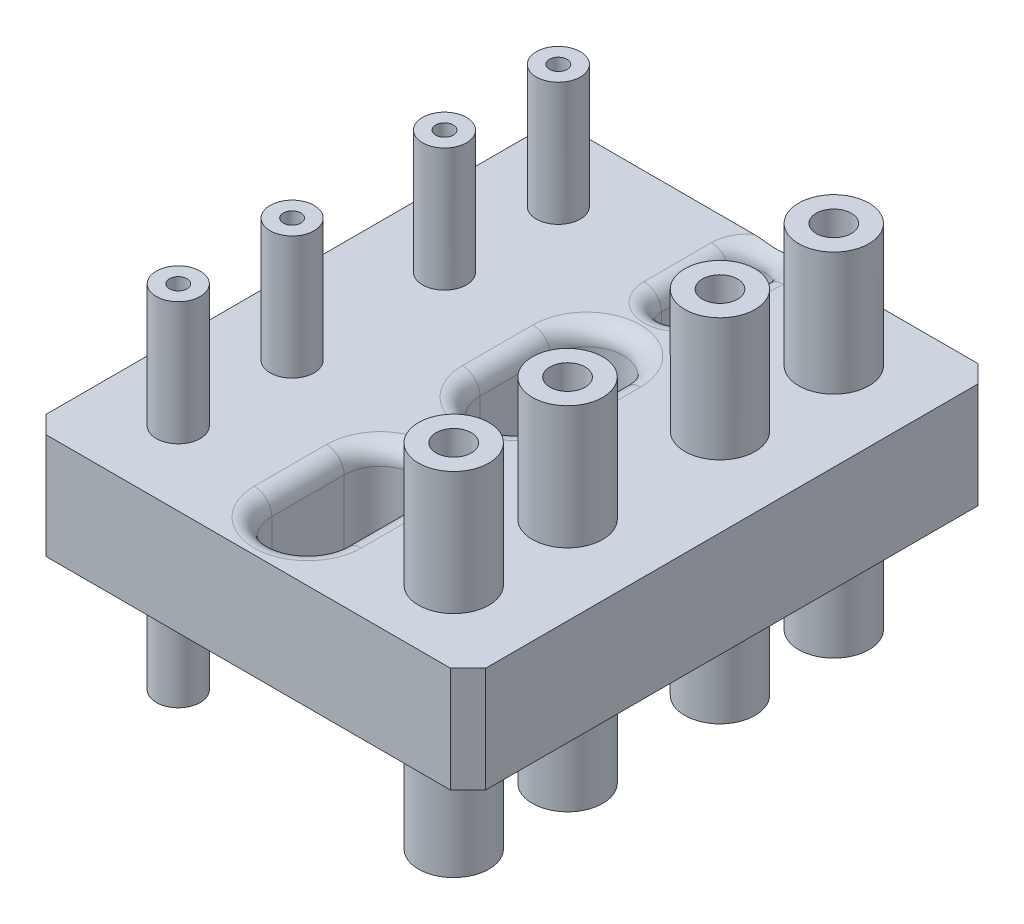
from build123d import *

# Parameters (mm, degrees)
BOSS_EXTRUDE1_START   = -10
SKETCH2_W             = 250
SKETCH2_H             = 150
BOSS_EXTRUDE1_DEPTH   = 40
SKETCH4_R             = 12.5
SKETCH4_R_2           = 20
BOSS_EXTRUDE2_DEPTH   = 70
MIRROR1_START         = -30
MIRROR1_OUTLINE_W     = 250
MIRROR1_OUTLINE_H     = 300
MIRROR1_DEPTH         = 60
MIRROR1_START_2       = -100
MIRROR1_2_OUTLINE_R   = 12.5
MIRROR1_2_OUTLINE_R_2 = 20
MIRROR1_2_DEPTH       = 200
CHAMFER1_SIZE         = 10
SKETCH5_R             = 10
SKETCH5_R_2           = 5
CUT_EXTRUDE1_DEPTH    = 155
CUT_EXTRUDE2_DEPTH    = 140
FILLET1_R             = 10


# Read off the part's stored shape, not the designer's step: Mirror1
with BuildPart() as part:
    # Sketch2 → Boss-Extrude1 (new body)
    with BuildSketch(Plane(origin=(0, 0, 0), x_dir=(1, 0, 0), z_dir=(0, 1, 0)).offset(BOSS_EXTRUDE1_START)):
        Rectangle(SKETCH2_W, SKETCH2_H)
    extrude(amount=BOSS_EXTRUDE1_DEPTH)

    # Sketch4 → Boss-Extrude2 (add)
    with BuildSketch(Plane(origin=(0, 30, 0), x_dir=(1, 0, 0), z_dir=(0, 1, 0))):
        with Locations(Location((-81.710606218, -33.069718751, 0), (0, 0, 270))):
            Circle(SKETCH4_R)
        with Locations(Location((-81.710606218, 31.672231224, 0), (0, 0, 270))):
            Circle(SKETCH4_R)
        with Locations(Location((74.923143721, 31.672231224, 0), (0, 0, 270))):
            Circle(SKETCH4_R_2)
        with Locations(Location((74.923143721, -33.069718751, 0), (0, 0, 270))):
            Circle(SKETCH4_R_2)
    extrude(amount=BOSS_EXTRUDE2_DEPTH)

    # Mirror1 outline → Mirror1 (add)
    with BuildSketch(Plane(origin=(0, 0, 0), x_dir=(1, 0, 0), z_dir=(0, 1, 0)).offset(MIRROR1_START)):
        with Locations((0, 75)):
            Rectangle(MIRROR1_OUTLINE_W, MIRROR1_OUTLINE_H)
    extrude(amount=MIRROR1_DEPTH)

    # Mirror1 2 outline → Mirror1 2 (add)
    with BuildSketch(Plane(origin=(0, 0, 0), x_dir=(1, 0, 0), z_dir=(0, 1, 0)).offset(MIRROR1_START_2)):
        with Locations((-81.710606218, -33.069718751)):
            Circle(MIRROR1_2_OUTLINE_R)
        with Locations((-81.710606218, 31.672231224)):
            Circle(MIRROR1_2_OUTLINE_R)
        with Locations((74.923143721, 31.672231224)):
            Circle(MIRROR1_2_OUTLINE_R_2)
        with Locations((74.923143721, -33.069718751)):
            Circle(MIRROR1_2_OUTLINE_R_2)
        with Locations((-81.710606218, 183.069718751)):
            Circle(MIRROR1_2_OUTLINE_R)
        with Locations((-81.710606218, 118.327768776)):
            Circle(MIRROR1_2_OUTLINE_R)
        with Locations((74.923143721, 118.327768776)):
            Circle(MIRROR1_2_OUTLINE_R_2)
        with Locations((74.923143721, 183.069718751)):
            Circle(MIRROR1_2_OUTLINE_R_2)
    extrude(amount=MIRROR1_2_DEPTH)

    # Chamfer1
    chamfer1_edges = [part.edges().sort_by_distance(p)[0] for p in [
        (125, 0, -225),
        (-125, 0, -225),
        (125, 0, 75),
        (-125, 0, 75),
    ]]
    chamfer(chamfer1_edges, length=CHAMFER1_SIZE)

    # Sketch5 → Cut-Extrude1 (cut, symmetric)
    with BuildSketch(Plane(origin=(0, 30, 0), x_dir=(1, 0, 0), z_dir=(0, 1, 0))):
        with Locations(Location((74.923143721, 183.069718751, 0), (0, 0, 270))):
            Circle(SKETCH5_R)
        with Locations(Location((74.923143721, 118.327768776, 0), (0, 0, 270))):
            Circle(SKETCH5_R)
        with Locations(Location((74.923143721, 31.672231224, 0), (0, 0, 270))):
            Circle(SKETCH5_R)
        with Locations(Location((74.923143721, -33.069718751, 0), (0, 0, 270))):
            Circle(SKETCH5_R)
        with Locations(Location((-81.710606218, -33.069718751, 0), (0, 0, 270))):
            Circle(SKETCH5_R_2)
        with Locations(Location((-81.710606218, 31.672231224, 0), (0, 0, 270))):
            Circle(SKETCH5_R_2)
        with Locations(Location((-81.710606218, 118.327768776, 0), (0, 0, 270))):
            Circle(SKETCH5_R_2)
        with Locations(Location((-81.710606218, 183.069718751, 0), (0, 0, 270))):
            Circle(SKETCH5_R_2)
    extrude(amount=CUT_EXTRUDE1_DEPTH, both=True, mode=Mode.SUBTRACT)

    # Sketch7 → Cut-Extrude2 (cut, symmetric)
    with BuildSketch(Plane(origin=(0, 30, 0), x_dir=(1, 0, 0), z_dir=(0, 1, 0))):
        with BuildLine():
            Line((20.426592509, 0), (20.426592509, -41.165027597))
            ThreePointArc((20.426592509, -41.165027597), (0, -61.591620106), (-20.426592509, -41.165027597))
            Line((-20.426592509, -41.165027597), (-20.426592509, 0))
            ThreePointArc((-20.426592509, 0), (0, 20.426592509), (20.426592509, 0))
        make_face()
        with BuildLine():
            Line((-20.614221034, 77.398424778), (-20.614221034, 117.499578133))
            ThreePointArc((-20.614221034, 117.499578133), (0, 138.113799167), (20.614221034, 117.499578133))
            Line((20.614221034, 117.499578133), (20.614221034, 77.398424778))
            ThreePointArc((20.614221034, 77.398424778), (0, 56.784203744), (-20.614221034, 77.398424778))
        make_face()
        with BuildLine():
            Line((-10.375628688, 170.39897192), (-10.375628688, 208.793693217))
            ThreePointArc((-10.375628688, 208.793693217), (0, 219.169321905), (10.375628688, 208.793693217))
            Line((10.375628688, 208.793693217), (10.375628688, 170.39897192))
            ThreePointArc((10.375628688, 170.39897192), (0, 160.023343232), (-10.375628688, 170.39897192))
        make_face()
    extrude(amount=CUT_EXTRUDE2_DEPTH, both=True, mode=Mode.SUBTRACT)

    # Fillet1
    # the kernel refuses this fillet: 10 mm, written as the material it takes off along each edge
    with BuildSketch(Plane(origin=(10.375628688, -30, -208.793693217), x_dir=(1, 0, 0), z_dir=(0, 0, 1)), Plane(origin=(-10.375628688, -30, -170.39897192), x_dir=(-1, 0, 0), z_dir=(0, 0, -1)), Plane(origin=(-10.375628688, 30, -208.793693217), x_dir=(-1, 0, 0), z_dir=(0, 0, 1)), Plane(origin=(10.375628688, 30, -170.39897192), x_dir=(1, 0, 0), z_dir=(0, 0, -1))) as fillet1_piece_1:
        with BuildLine():
            CenterArc((FILLET1_R, FILLET1_R), FILLET1_R, 180, 90)
            Line((0, FILLET1_R), (0, 0))
            Line((0, 0), (FILLET1_R, 0))
        make_face()
    extrude(amount=38.394721297, mode=Mode.SUBTRACT)
    with BuildSketch(Plane(origin=(0, -30, -208.793693217), x_dir=(1, 0, 0), z_dir=(0, 0, 1))) as fillet1_piece_2:
        with BuildLine():
            CenterArc((10.375628688 + FILLET1_R, FILLET1_R), FILLET1_R, 180, 90)
            Line((10.375628688, FILLET1_R), (10.375628688, 0))
            Line((10.375628688, 0), (10.375628688 + FILLET1_R, 0))
        make_face()
    revolve(axis=Axis((0, -30, -208.793693217), (0, 1, 0)), revolution_arc=180, mode=Mode.SUBTRACT)
    with BuildSketch(Plane(origin=(0, -30, -170.39897192), x_dir=(-1, 0, 0), z_dir=(0, 0, -1))) as fillet1_piece_3:
        with BuildLine():
            CenterArc((10.375628688 + FILLET1_R, FILLET1_R), FILLET1_R, 180, 90)
            Line((10.375628688, FILLET1_R), (10.375628688, 0))
            Line((10.375628688, 0), (10.375628688 + FILLET1_R, 0))
        make_face()
    revolve(axis=Axis((0, -30, -170.39897192), (0, 1, 0)), revolution_arc=180, mode=Mode.SUBTRACT)
    with BuildSketch(Plane(origin=(20.614221034, -30, -117.499578133), x_dir=(1, 0, 0), z_dir=(0, 0, 1)), Plane(origin=(-20.614221034, -30, -77.398424778), x_dir=(-1, 0, 0), z_dir=(0, 0, -1)), Plane(origin=(-20.614221034, 30, -117.499578133), x_dir=(-1, 0, 0), z_dir=(0, 0, 1)), Plane(origin=(20.614221034, 30, -77.398424778), x_dir=(1, 0, 0), z_dir=(0, 0, -1))) as fillet1_piece_4:
        with BuildLine():
            CenterArc((FILLET1_R, FILLET1_R), FILLET1_R, 180, 90)
            Line((0, FILLET1_R), (0, 0))
            Line((0, 0), (FILLET1_R, 0))
        make_face()
    extrude(amount=40.101153355, mode=Mode.SUBTRACT)
    with BuildSketch(Plane(origin=(0, -30, -117.499578133), x_dir=(1, 0, 0), z_dir=(0, 0, 1))) as fillet1_piece_5:
        with BuildLine():
            CenterArc((20.614221034 + FILLET1_R, FILLET1_R), FILLET1_R, 180, 90)
            Line((20.614221034, FILLET1_R), (20.614221034, 0))
            Line((20.614221034, 0), (20.614221034 + FILLET1_R, 0))
        make_face()
    revolve(axis=Axis((0, -30, -117.499578133), (0, 1, 0)), revolution_arc=180, mode=Mode.SUBTRACT)
    with BuildSketch(Plane(origin=(0, -30, -77.398424778), x_dir=(-1, 0, 0), z_dir=(0, 0, -1))) as fillet1_piece_6:
        with BuildLine():
            CenterArc((20.614221034 + FILLET1_R, FILLET1_R), FILLET1_R, 180, 90)
            Line((20.614221034, FILLET1_R), (20.614221034, 0))
            Line((20.614221034, 0), (20.614221034 + FILLET1_R, 0))
        make_face()
    revolve(axis=Axis((0, -30, -77.398424778), (0, 1, 0)), revolution_arc=180, mode=Mode.SUBTRACT)
    with BuildSketch(Plane(origin=(-20.426592509, -30, 41.165027597), x_dir=(-1, 0, 0), z_dir=(0, 0, -1)), Plane(origin=(20.426592509, -30, 0), x_dir=(1, 0, 0), z_dir=(0, 0, 1)), Plane(origin=(20.426592509, 30, 41.165027597), x_dir=(1, 0, 0), z_dir=(0, 0, -1)), Plane(origin=(-20.426592509, 30, 0), x_dir=(-1, 0, 0), z_dir=(0, 0, 1))) as fillet1_piece_7:
        with BuildLine():
            CenterArc((FILLET1_R, FILLET1_R), FILLET1_R, 180, 90)
            Line((0, FILLET1_R), (0, 0))
            Line((0, 0), (FILLET1_R, 0))
        make_face()
    extrude(amount=41.165027597, mode=Mode.SUBTRACT)
    with BuildSketch(Plane(origin=(0, -30, 41.165027597), x_dir=(-1, 0, 0), z_dir=(0, 0, -1))) as fillet1_piece_8:
        with BuildLine():
            CenterArc((20.426592509 + FILLET1_R, FILLET1_R), FILLET1_R, 180, 90)
            Line((20.426592509, FILLET1_R), (20.426592509, 0))
            Line((20.426592509, 0), (20.426592509 + FILLET1_R, 0))
        make_face()
    revolve(axis=Axis((0, -30, 41.165027597), (0, 1, 0)), revolution_arc=180, mode=Mode.SUBTRACT)
    with BuildSketch(Plane(origin=(0, -30, 0), x_dir=(1, 0, 0), z_dir=(0, 0, 1))) as fillet1_piece_9:
        with BuildLine():
            CenterArc((20.426592509 + FILLET1_R, FILLET1_R), FILLET1_R, 180, 90)
            Line((20.426592509, FILLET1_R), (20.426592509, 0))
            Line((20.426592509, 0), (20.426592509 + FILLET1_R, 0))
        make_face()
    revolve(axis=Axis((0, -30, 0), (0, 1, 0)), revolution_arc=180, mode=Mode.SUBTRACT)
    with BuildSketch(Plane(origin=(0, 30, 0), x_dir=(1, 0, 0), z_dir=(0, 0, 1))) as fillet1_piece_10:
        with BuildLine():
            CenterArc((20.426592509 + FILLET1_R, -FILLET1_R), FILLET1_R, 90, 90)
            Line((20.426592509, -FILLET1_R), (20.426592509, 0))
            Line((20.426592509, 0), (20.426592509 + FILLET1_R, 0))
        make_face()
    revolve(axis=Axis((0, 30, 0), (0, 1, 0)), revolution_arc=180, mode=Mode.SUBTRACT)
    with BuildSketch(Plane(origin=(0, 30, 41.165027597), x_dir=(-1, 0, 0), z_dir=(0, 0, -1))) as fillet1_piece_11:
        with BuildLine():
            CenterArc((20.426592509 + FILLET1_R, -FILLET1_R), FILLET1_R, 90, 90)
            Line((20.426592509, -FILLET1_R), (20.426592509, 0))
            Line((20.426592509, 0), (20.426592509 + FILLET1_R, 0))
        make_face()
    revolve(axis=Axis((0, 30, 41.165027597), (0, 1, 0)), revolution_arc=180, mode=Mode.SUBTRACT)
    with BuildSketch(Plane(origin=(0, 30, -77.398424778), x_dir=(-1, 0, 0), z_dir=(0, 0, -1))) as fillet1_piece_12:
        with BuildLine():
            CenterArc((20.614221034 + FILLET1_R, -FILLET1_R), FILLET1_R, 90, 90)
            Line((20.614221034, -FILLET1_R), (20.614221034, 0))
            Line((20.614221034, 0), (20.614221034 + FILLET1_R, 0))
        make_face()
    revolve(axis=Axis((0, 30, -77.398424778), (0, 1, 0)), revolution_arc=180, mode=Mode.SUBTRACT)
    with BuildSketch(Plane(origin=(0, 30, -117.499578133), x_dir=(1, 0, 0), z_dir=(0, 0, 1))) as fillet1_piece_13:
        with BuildLine():
            CenterArc((20.614221034 + FILLET1_R, -FILLET1_R), FILLET1_R, 90, 90)
            Line((20.614221034, -FILLET1_R), (20.614221034, 0))
            Line((20.614221034, 0), (20.614221034 + FILLET1_R, 0))
        make_face()
    revolve(axis=Axis((0, 30, -117.499578133), (0, 1, 0)), revolution_arc=180, mode=Mode.SUBTRACT)
    with BuildSketch(Plane(origin=(0, 30, -170.39897192), x_dir=(-1, 0, 0), z_dir=(0, 0, -1))) as fillet1_piece_14:
        with BuildLine():
            CenterArc((10.375628688 + FILLET1_R, -FILLET1_R), FILLET1_R, 90, 90)
            Line((10.375628688, -FILLET1_R), (10.375628688, 0))
            Line((10.375628688, 0), (10.375628688 + FILLET1_R, 0))
        make_face()
    revolve(axis=Axis((0, 30, -170.39897192), (0, 1, 0)), revolution_arc=180, mode=Mode.SUBTRACT)
    with BuildSketch(Plane(origin=(0, 30, -208.793693217), x_dir=(1, 0, 0), z_dir=(0, 0, 1))) as fillet1_piece_15:
        with BuildLine():
            CenterArc((10.375628688 + FILLET1_R, -FILLET1_R), FILLET1_R, 90, 90)
            Line((10.375628688, -FILLET1_R), (10.375628688, 0))
            Line((10.375628688, 0), (10.375628688 + FILLET1_R, 0))
        make_face()
    revolve(axis=Axis((0, 30, -208.793693217), (0, 1, 0)), revolution_arc=180, mode=Mode.SUBTRACT)


solid = part.part
